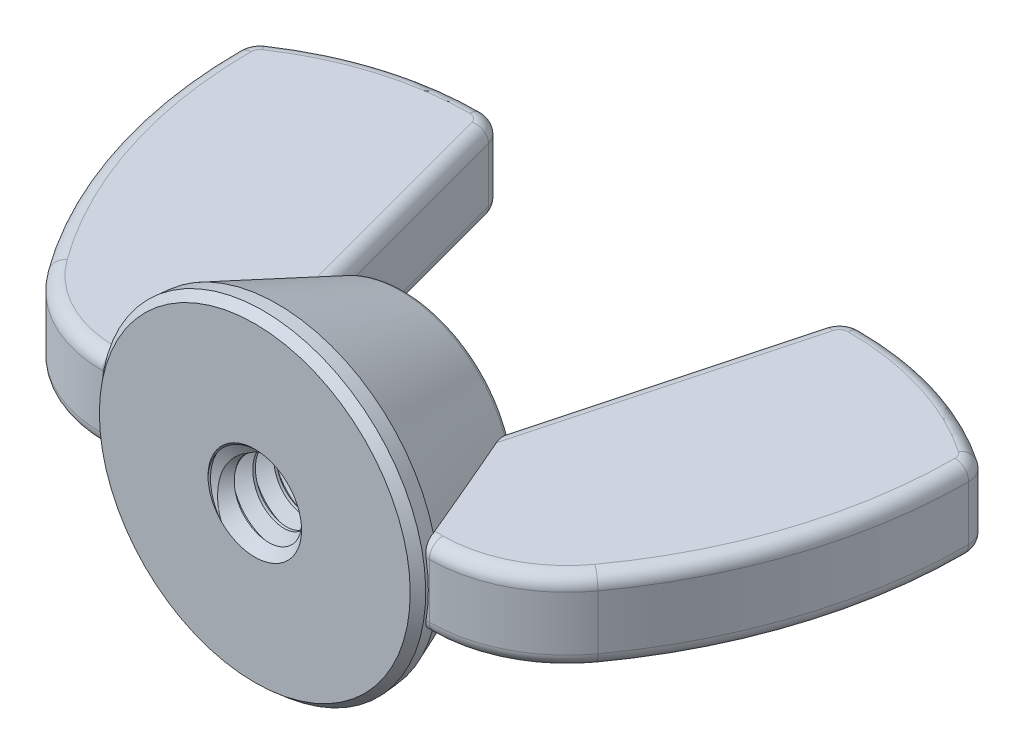
from build123d import *

# Parameters (mm, degrees)
EXTRUDE2_DEPTH     = 1.240234375
SKETCH3_R          = 4.9609375
EXTRUDE1_DEPTH     = 0.6858
EXTRUDE1_DRAFT     = -5
SKETCH15_R         = 4.900937775
EXTRUDE3_DEPTH     = 3.8862
EXTRUDE3_TAPER     = 22.116049887
FILLET3_R          = 0.254
SKETCH4_R          = 1.4224
CUT_EXTRUDE1_DEPTH = 18.58944448
SWEEP1_PITCH       = 0.635
SKETCH7_R          = 4.9609375
CUT_EXTRUDE2_DEPTH = 18.589444509
SKETCH8_R          = 4.900937775
CUT_EXTRUDE3_DEPTH = 15.634307026
SKETCH11_R         = 1.3716
CUT_EXTRUDE5_DEPTH = 15.634306992
CUT_EXTRUDE5_TAPER = 45
CHAMFER1_SIZE      = 0.257175
CHAMFER1_SIZE2     = 0.237388559
FILLET4_R          = 0.413411458


with BuildPart() as part:
    # Sketch13 → Extrude2 (new, symmetric)
    with BuildSketch(Plane(origin=(0, 0, 0), x_dir=(1, 0, 0), z_dir=(0, 1, 0))):
        with BuildLine():
            Line((3.043482358, 0.3429), (4.9609375, 0.3429))
            ThreePointArc((4.9609375, 0.3429), (6.865108063, 0.80061602), (8.353223522, 2.073754611))
            ThreePointArc((8.353223522, 2.073754611), (10.405439122, 6.109849745), (11.1125, 10.582177742))
            ThreePointArc((11.1125, 10.582177742), (11.031848656, 10.905652614), (10.808775492, 11.153400462))
            ThreePointArc((10.808775492, 11.153400462), (8.394996342, 12.304714058), (5.750076343, 12.7))
            ThreePointArc((5.750076343, 12.7), (5.330628092, 12.557616505), (5.084535002, 12.189312168))
            Line((5.084535002, 12.189312168), (3.043482358, 4.572))
            Line((3.043482358, 4.572), (3.043482358, 0.3429))
        make_face()
    extrude(amount=EXTRUDE2_DEPTH, both=True)

    # Fillet4
    fillet4_edges = [part.edges().sort_by_distance(p)[0] for p in [
        (6.865108063, 1.240234375, -0.80061602),
        (4.002209929, -1.240234375, -0.3429),
        (10.405439122, 1.240234375, -6.109849745),
        (11.031848656, 1.240234375, -10.905652614),
        (8.394996342, 1.240234375, -12.304714058),
        (5.330628092, 1.240234375, -12.557616505),
        (4.06400868, 1.240234375, -8.380656084),
        (4.002209929, 1.240234375, -0.3429),
        (4.06400868, -1.240234375, -8.380656084),
        (5.330628092, -1.240234375, -12.557616505),
        (8.394996342, -1.240234375, -12.304714058),
        (11.031848656, -1.240234375, -10.905652614),
        (10.405439122, -1.240234375, -6.109849745),
        (6.865108063, -1.240234375, -0.80061602),
    ]]
    fillet(fillet4_edges, radius=FILLET4_R)


with BuildPart() as body_2:
    # Sketch3 → Extrude1 (with draft: the straight prism first)
    with BuildSketch(Plane.XY):
        Circle(SKETCH3_R)
    extrude(amount=-EXTRUDE1_DEPTH)
    # Extrude1: the draft: its side faces are tilted about the plane it starts from
    extrude1_sides = [body_2.faces().sort_by_distance(p)[0] for p in [
        (-4.9609375, 0, -0.3429),
    ]]
    draft(extrude1_sides, Plane.XY, EXTRUDE1_DRAFT)

    # Sketch15 → Extrude3 (add)
    with BuildSketch(Plane(origin=(0, 0, -0.6858), x_dir=(-1, 0, 0), z_dir=(0, 0, -1))):
        Circle(SKETCH15_R)
    extrude(amount=EXTRUDE3_DEPTH, taper=EXTRUDE3_TAPER)

    # Fillet3
    fillet3_edges = [body_2.edges().sort_by_distance(p)[0] for p in [
        (3.321647339, 0, -4.572),
    ]]
    fillet(fillet3_edges, radius=FILLET3_R)

    # Sketch4 → Cut-Extrude1 (cut, through all)
    with BuildSketch(Plane.XY):
        Circle(SKETCH4_R)
    extrude(amount=-CUT_EXTRUDE1_DEPTH, mode=Mode.SUBTRACT)

    # Sweep1: the profile of Sketch6 profile screwed along a right-hand helix of 12.2 turns, 6 arcs to a turn; built about Z, then put on its axis
    sweep1_z = Axis((0, 0, 0), (0, 0, 1))
    sweep1_corners = [(1.4227, 0, -0.555798205), (1.009955401, 0, -0.3175), (1.009955401, 0, -0.238125), (1.4227, 0, 0.000173205)]
    with BuildLine(mode=Mode.PRIVATE) as sweep1_profile:
        Line(sweep1_corners[0], sweep1_corners[1])
        Line(sweep1_corners[1], sweep1_corners[2])
        Line(sweep1_corners[2], sweep1_corners[3])
        Line(sweep1_corners[3], sweep1_corners[0])
    sweep1_cap = Face(sweep1_profile.wire())
    sweep1_turn_angles = [0, 30, 60, 90, 120, 150, 180, 210, 240, 270, 300, 330, 360]
    sweep1_turn_weights = [1, 0.8660254037844387, 1, 0.8660254037844387, 1, 0.8660254037844387, 1, 0.8660254037844387, 1, 0.8660254037844387, 1, 0.8660254037844387, 1]
    sweep1_turn_rails = [Edge.make_bspline([Vector(p[0], p[1], 0).rotate(sweep1_z, sweep1_turn_angles[k]) / sweep1_turn_weights[k] + Vector(0, 0, p[2] + SWEEP1_PITCH * sweep1_turn_angles[k] / 360) for k in range(13)], [0, 0, 0, 1, 1, 2, 2, 3, 3, 4, 4, 5, 5, 6, 6, 6], 2, sweep1_turn_weights) for p in sweep1_corners]
    sweep1_turn_sides = [Face.make_surface_from_curves(sweep1_turn_rails[p[0]], sweep1_turn_rails[p[1]]) for p in [(0, 1), (1, 2), (2, 3), (3, 0)]]
    sweep1_last_angles = [4320, 4350, 4380, 4386, 4392]
    sweep1_last_weights = [1, 0.8660254037844387, 1, 0.9945218953682684, 1]
    sweep1_last_rails = [Edge.make_bspline([Vector(p[0], p[1], 0).rotate(sweep1_z, sweep1_last_angles[k]) / sweep1_last_weights[k] + Vector(0, 0, p[2] + SWEEP1_PITCH * sweep1_last_angles[k] / 360) for k in range(5)], [0, 0, 0, 1, 1, 2, 2, 2], 2, sweep1_last_weights) for p in sweep1_corners]
    sweep1_last_sides = [Face.make_surface_from_curves(sweep1_last_rails[p[0]], sweep1_last_rails[p[1]]) for p in [(0, 1), (1, 2), (2, 3), (3, 0)]]
    sweep1 = Plane(origin=(0, 0, 0), x_dir=(-1, 0, 0), z_dir=(0, 0, -1)) * Solid(Shell([*[p.moved(Location((0, 0, SWEEP1_PITCH * i))) for i in range(12) for p in sweep1_turn_sides], *sweep1_last_sides, sweep1_cap, sweep1_cap.rotate(sweep1_z, 4392).moved(Location((0, 0, SWEEP1_PITCH * 4392 / 360)))]))
    add(sweep1)

    # Sketch7 → Cut-Extrude2 (cut, through all)
    with BuildSketch(Plane.XY):
        Circle(SKETCH7_R)
    extrude(amount=CUT_EXTRUDE2_DEPTH, mode=Mode.SUBTRACT)

    # Sketch8 → Cut-Extrude3 (cut, through all)
    with BuildSketch(Plane.XY.offset(-4.572)):
        Circle(SKETCH8_R)
    extrude(amount=-CUT_EXTRUDE3_DEPTH, mode=Mode.SUBTRACT)

    # Cut-Extrude4 cone 1 section (through the dimple's axis) → Cut-Extrude4 (revolve, cut)
    with BuildSketch(Plane(origin=(0, 0, 0), x_dir=(0, -1, 0), z_dir=(1, 0, 0))):
        Polygon((0, 0), (1.4224, 0), (0, 1.4224), align=None)
    revolve(axis=Axis((0, 0, 0), (0, 0, -1)), mode=Mode.SUBTRACT)

    # Sketch11 → Cut-Extrude5 (cut, through all)
    with BuildSketch(Plane.XY.offset(-4.572)):
        Circle(SKETCH11_R)
    extrude(amount=CUT_EXTRUDE5_DEPTH, taper=CUT_EXTRUDE5_TAPER, mode=Mode.SUBTRACT)

    # Chamfer1
    chamfer1_edges = [body_2.edges().sort_by_distance(p)[0] for p in [
        (-4.9609375, 0, 0),
    ]]
    chamfer1_side = [body_2.faces().sort_by_distance(p)[0] for p in [
        (-4.930937637, 0, -0.3429),
    ]]
    chamfer(chamfer1_edges, length=CHAMFER1_SIZE, length2=CHAMFER1_SIZE2, reference=chamfer1_side[0])


with BuildPart() as body_3:
    # Mirror6: mirrored copy
    add(part.part.mirror(Plane(origin=(0, 0, 0), x_dir=(0, 0, 1), z_dir=(1, 0, 0))))

    # Combine2: union part, body 2
    add(part.part)
    add(body_2.part)


solid = body_3.part
